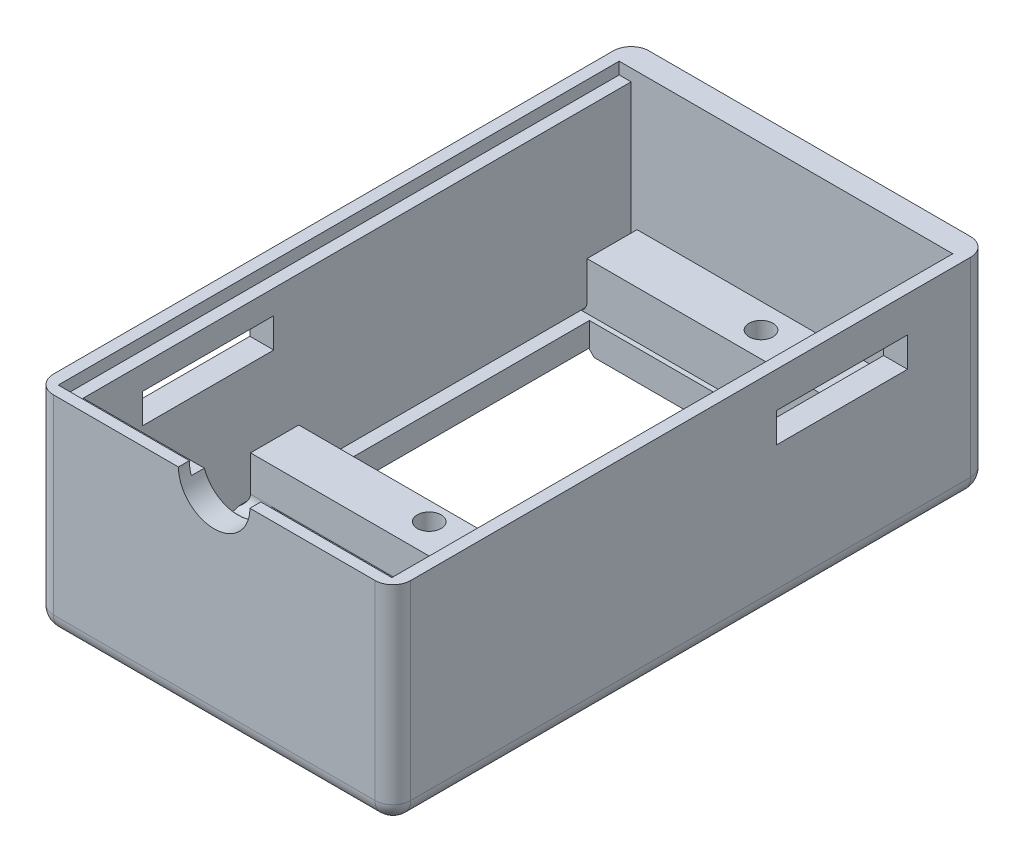
from build123d import *

# Parameters (mm, degrees)
BOSS_EXTRUDE1_DEPTH = 17.5
CUT_EXTRUDE1_DEPTH  = 15.5
SKETCH7_W           = 23.8
SKETCH7_H           = 23.8
CUT_EXTRUDE4_DEPTH  = 37.949289574
SKETCH7_5_W         = 25
SKETCH7_5_H         = 4.2
SKETCH7_5_R         = 1
BOSS_EXTRUDE3_DEPTH = 4
FILLET2_R           = 1.5
CUT_EXTRUDE6_REACH  = 46.612
SKETCH14_W          = 11
SKETCH14_H          = 2.5
SKETCH20_W          = 11
SKETCH20_H          = 2.5
CUT_EXTRUDE7_DEPTH  = 45.612218057
SKETCH21_W          = 24
SKETCH21_H          = 17.1
SKETCH21_H_2        = 3.6
BOSS_EXTRUDE4_DEPTH = 0.5
CHAMFER2_SIZE       = 0.5
CUT_EXTRUDE8_DEPTH  = 1
CUT_EXTRUDE9_REACH  = 57.057
FILLET3_R           = 1


# Some blends are built 0.0001 mm under size
with BuildPart() as part:
    # Sketch1 → Boss-Extrude1 (new body)
    with BuildSketch(Plane(origin=(0, 0, 0), x_dir=(1, 0, 0), z_dir=(0, 1, 0))):
        Polygon((-15, 20), (15, 20), (15, -20), (15, -30), (-15, -30), (-15, -20), align=None)
    extrude(amount=BOSS_EXTRUDE1_DEPTH)

    # Sketch2 → Cut-Extrude1 (cut)
    with BuildSketch(Plane(origin=(0, 17.5, 0), x_dir=(1, 0, 0), z_dir=(0, 1, 0))):
        Polygon((-13, 18), (13, 18), (13, -18), (13, -28), (-13, -28), (-13, -18), align=None)
    extrude(amount=-CUT_EXTRUDE1_DEPTH, mode=Mode.SUBTRACT)

    # Sketch7 → Cut-Extrude4 (cut, through all)
    with BuildSketch(Plane(origin=(0, 2, 0), x_dir=(1, 0, 0), z_dir=(0, 1, 0))):
        with Locations((0, 1.5)):
            Rectangle(SKETCH7_W, SKETCH7_H)
    extrude(amount=-CUT_EXTRUDE4_DEPTH, mode=Mode.SUBTRACT)

    # Sketch7<5> → Boss-Extrude3 (add)
    # profile 1 of 2: a face of its own
    with BuildSketch(Plane(origin=(0, 2, 0), x_dir=(1, 0, 0), z_dir=(0, 1, 0))):
        with Locations((0, 15.9)):
            Rectangle(SKETCH7_5_W, SKETCH7_5_H)
        with Locations(Location((0, 15.903889524, 0), (0, 0, 270))):
            Circle(SKETCH7_5_R, mode=Mode.SUBTRACT)
    # profile 2 of 2: a face of its own
    with BuildSketch(Plane(origin=(0, 2, 0), x_dir=(1, 0, 0), z_dir=(0, 1, 0))):
        Polygon((-11.9, -10.4), (-12.5, -10.4), (-12.5, -14.45), (0, -14.45), (12.5, -14.45), (12.5, -10.4), align=None)
        with Locations(Location((0, -11.95, 0), (0, 0, 90))):
            Circle(SKETCH7_5_R, mode=Mode.SUBTRACT)
    extrude(amount=BOSS_EXTRUDE3_DEPTH)

    # Fillet2
    fillet2_edges = [part.edges().sort_by_distance(p)[0] for p in [
        (15, 8.75, 30),
        (-15, 8.75, 30),
        (-15, 8.75, -20),
        (15, 8.75, -20),
        (0, 0, 30),
        (-15, 0, 5),
        (0, 0, -20),
        (15, 0, 5),
    ]]
    fillet(fillet2_edges, radius=FILLET2_R)

    # Sketch14 → Cut-Extrude6 (cut, up to next)
    with BuildSketch(Plane(origin=(-13, 0, 0), x_dir=(0, 0, -1), z_dir=(1, 0, 0)), mode=Mode.PRIVATE) as cut_extrude6_sk1:
        with Locations((-17.5, 13.25)):
            Rectangle(SKETCH14_W, SKETCH14_H)
    cut_extrude6_tool1 = extrude(cut_extrude6_sk1.sketch, amount=-CUT_EXTRUDE6_REACH, mode=Mode.PRIVATE) & part.part
    add(cut_extrude6_tool1.solids().sort_by_distance((-13, 13.25, 17.5))[0], mode=Mode.SUBTRACT)

    # Sketch20 → Cut-Extrude7 (cut, through all)
    with BuildSketch(Plane.ZY.offset(-13)):
        with Locations((-7.698338616, 13.25)):
            Rectangle(SKETCH20_W, SKETCH20_H)
    extrude(amount=-CUT_EXTRUDE7_DEPTH, mode=Mode.SUBTRACT)

    # Sketch21 → Boss-Extrude4 (add)
    with BuildSketch(Plane.XZ):
        with Locations((0, 18.95)):
            Rectangle(SKETCH21_W, SKETCH21_H)
        with Locations((0, -15.2)):
            Rectangle(SKETCH21_W, SKETCH21_H_2)
    extrude(amount=BOSS_EXTRUDE4_DEPTH)

    # Chamfer2
    chamfer2_edges = [part.edges().sort_by_distance(p)[0] for p in [
        (12, -0.5, 18.95),
        (-12, -0.5, 18.95),
        (-12, -0.5, -15.2),
        (0, -0.5, -17),
        (12, -0.5, -15.2),
        (0, -0.5, 27.5),
    ]]
    chamfer(chamfer2_edges, length=CHAMFER2_SIZE - 0.0001)  # a hair under: the kernel refuses the full size

    # Sketch22 → Cut-Extrude8 (cut)
    with BuildSketch(Plane(origin=(0, 17.5, 0), x_dir=(1, 0, 0), z_dir=(0, 1, 0))):
        Polygon((-13, 18), (-14, 18), (-14, -19.085850071), (-14, -29.085850071), (14, -29.085850071), (14, -19.085850071), (14, 18), (13, 18), (13, -28), (-13, -28), align=None)
    extrude(amount=-CUT_EXTRUDE8_DEPTH, mode=Mode.SUBTRACT)

    # Sketch23 → Cut-Extrude9 (cut, up to next)
    with BuildSketch(Plane.XY.offset(30), mode=Mode.PRIVATE) as cut_extrude9_sk1:
        with BuildLine():
            Line((-3, 17.5), (3, 17.5))
            ThreePointArc((3, 17.5), (0, 14.5), (-3, 17.5))
        make_face()
    cut_extrude9_tool1 = extrude(cut_extrude9_sk1.sketch, amount=-CUT_EXTRUDE9_REACH, mode=Mode.PRIVATE) & part.part
    add(cut_extrude9_tool1.solids().sort_by_distance((0, 16.22676, 30))[0], mode=Mode.SUBTRACT)

    # Fillet3
    # the kernel refuses this fillet: 1 mm, written as the material it adds along each edge
    with BuildSketch(Plane(origin=(12.5, 2, -13.8), x_dir=(1, 0, 0), z_dir=(0, 0, -1))) as fillet3_piece_1_section:
        with BuildLine():
            CenterArc((1, -0.866025404), FILLET3_R, 120, 60)
            Line((0, -0.866025404), (0, 0))
            Line((0, 0), (0.5, 0))
        make_face()
    fillet3_piece_1 = extrude(amount=6.365063509, mode=Mode.PRIVATE)
    fillet3_piece_1 = split(fillet3_piece_1, bisect_by=Plane(origin=(12.5, 2, -20), z_dir=(0, 0, 1)), keep=Keep.TOP, mode=Mode.PRIVATE)
    add(fillet3_piece_1)
    with BuildSketch(Plane(origin=(-12.5, 2, -20.165063509), x_dir=(-1, 0, 0), z_dir=(0, 0, 1))) as fillet3_piece_2_section:
        with BuildLine():
            CenterArc((1, -0.866025404), FILLET3_R, 120, 60)
            Line((0, -0.866025404), (0, 0))
            Line((0, 0), (0.5, 0))
        make_face()
    fillet3_piece_2 = extrude(amount=6.365063509, mode=Mode.PRIVATE)
    fillet3_piece_2 = split(fillet3_piece_2, bisect_by=Plane(origin=(-12.5, 2, -20), z_dir=(0, 0, 1)), keep=Keep.TOP, mode=Mode.PRIVATE)
    add(fillet3_piece_2)
    with BuildSketch(Plane(origin=(-12.5, 2, 10.4), x_dir=(-1, 0, 0), z_dir=(0, 0, 1)), Plane(origin=(12.5, 2, 14.45), x_dir=(1, 0, 0), z_dir=(0, 0, -1))) as fillet3_piece_3:
        with BuildLine():
            CenterArc((FILLET3_R, -FILLET3_R), FILLET3_R, 90, 90)
            Line((0, -FILLET3_R), (0, 0))
            Line((0, 0), (FILLET3_R, 0))
        make_face()
    extrude(amount=4.05)
    with BuildSketch(Plane(origin=(-12.5, 2, 14.45), x_dir=(0, 0, 1), z_dir=(1, 0, 0))) as fillet3_piece_4:
        with BuildLine():
            CenterArc((FILLET3_R, -FILLET3_R), FILLET3_R, 90, 90)
            Line((0, -FILLET3_R), (0, 0))
            Line((0, 0), (FILLET3_R, 0))
        make_face()
    extrude(amount=25)
    with BuildSketch(Plane(origin=(-15, 2, 14.45), x_dir=(0, 0, 1), z_dir=(1, 0, 0))) as fillet3_piece_5a_section:
        with BuildLine():
            CenterArc((FILLET3_R, -FILLET3_R), FILLET3_R, 90, 90)
            Line((0, -FILLET3_R), (0, 0))
            Line((0, 0), (FILLET3_R, 0))
        make_face()
    fillet3_piece_5a = extrude(amount=27.5, mode=Mode.PRIVATE)
    fillet3_piece_5a = split(fillet3_piece_5a, bisect_by=Plane(origin=(-13, 2, 14.45), z_dir=(1, 0, 0)), keep=Keep.TOP, mode=Mode.PRIVATE)
    fillet3_piece_5a = split(fillet3_piece_5a, bisect_by=Plane(origin=(-12.5, 2, 14.45), z_dir=(-1, 0, 0)), keep=Keep.TOP, mode=Mode.PRIVATE)
    with BuildSketch(Plane(origin=(-12.5, 2, 10.4), x_dir=(-1, 0, 0), z_dir=(0, 0, 1))) as fillet3_piece_5b_section:
        with BuildLine():
            CenterArc((FILLET3_R, -FILLET3_R), FILLET3_R, 90, 90)
            Line((0, -FILLET3_R), (0, 0))
            Line((0, 0), (FILLET3_R, 0))
        make_face()
    fillet3_piece_5b = extrude(amount=6.55, mode=Mode.PRIVATE)
    fillet3_piece_5b = split(fillet3_piece_5b, bisect_by=Plane(origin=(-13, 2, 10.4), z_dir=(1, 0, 0)), keep=Keep.TOP, mode=Mode.PRIVATE)
    fillet3_piece_5b = split(fillet3_piece_5b, bisect_by=Plane(origin=(-12.5, 2, 14.45), z_dir=(0, 0, 1)), keep=Keep.TOP, mode=Mode.PRIVATE)
    fillet3_piece_5 = fillet3_piece_5a & fillet3_piece_5b
    add(fillet3_piece_5)
    with BuildSketch(Plane(origin=(12.5, 2, 16.95), x_dir=(1, 0, 0), z_dir=(0, 0, -1))) as fillet3_piece_6a_section:
        with BuildLine():
            CenterArc((FILLET3_R, -FILLET3_R), FILLET3_R, 90, 90)
            Line((0, -FILLET3_R), (0, 0))
            Line((0, 0), (FILLET3_R, 0))
        make_face()
    fillet3_piece_6a = extrude(amount=6.55, mode=Mode.PRIVATE)
    fillet3_piece_6a = split(fillet3_piece_6a, bisect_by=Plane(origin=(13, 2, 16.95), z_dir=(-1, 0, 0)), keep=Keep.TOP, mode=Mode.PRIVATE)
    fillet3_piece_6a = split(fillet3_piece_6a, bisect_by=Plane(origin=(12.5, 2, 14.45), z_dir=(0, 0, 1)), keep=Keep.TOP, mode=Mode.PRIVATE)
    with BuildSketch(Plane(origin=(-12.5, 2, 14.45), x_dir=(0, 0, 1), z_dir=(1, 0, 0))) as fillet3_piece_6b_section:
        with BuildLine():
            CenterArc((FILLET3_R, -FILLET3_R), FILLET3_R, 90, 90)
            Line((0, -FILLET3_R), (0, 0))
            Line((0, 0), (FILLET3_R, 0))
        make_face()
    fillet3_piece_6b = extrude(amount=27.5, mode=Mode.PRIVATE)
    fillet3_piece_6b = split(fillet3_piece_6b, bisect_by=Plane(origin=(13, 2, 14.45), z_dir=(-1, 0, 0)), keep=Keep.TOP, mode=Mode.PRIVATE)
    fillet3_piece_6b = split(fillet3_piece_6b, bisect_by=Plane(origin=(12.5, 2, 14.45), z_dir=(1, 0, 0)), keep=Keep.TOP, mode=Mode.PRIVATE)
    fillet3_piece_6 = fillet3_piece_6a & fillet3_piece_6b
    add(fillet3_piece_6)


solid = part.part
